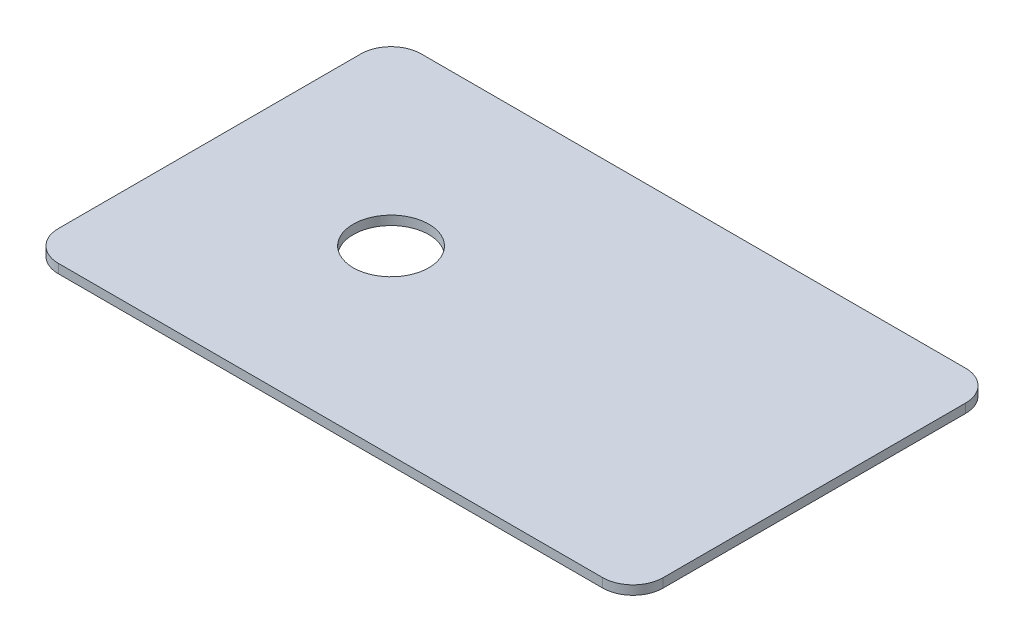
from build123d import *

# Parameters (mm, degrees)
SKETCH1_W           = 200
SKETCH1_H           = 120
BOSS_EXTRUDE1_DEPTH = 3
SKETCH2_R           = 12.5
CUT_EXTRUDE1_DEPTH  = 117.657618697
FILLET3_R           = 10


with BuildPart() as part:
    # Sketch1 → Boss-Extrude1 (new body)
    with BuildSketch(Plane(origin=(0, 0, 0), x_dir=(1, 0, 0), z_dir=(0, 1, 0))):
        Rectangle(SKETCH1_W, SKETCH1_H)
    extrude(amount=BOSS_EXTRUDE1_DEPTH)

    # Sketch2 → Cut-Extrude1 (cut, through all)
    with BuildSketch(Plane(origin=(0, 3, 0), x_dir=(1, 0, 0), z_dir=(0, 1, 0))):
        with Locations((-40, 0)):
            Circle(SKETCH2_R)
    extrude(amount=-CUT_EXTRUDE1_DEPTH, mode=Mode.SUBTRACT)

    # Fillet3
    fillet3_edges = [part.edges().sort_by_distance(p)[0] for p in [
        (100, 1.5, -60),
        (100, 1.5, 60),
        (-100, 1.5, 60),
        (-100, 1.5, -60),
    ]]
    fillet(fillet3_edges, radius=FILLET3_R)


solid = part.part
